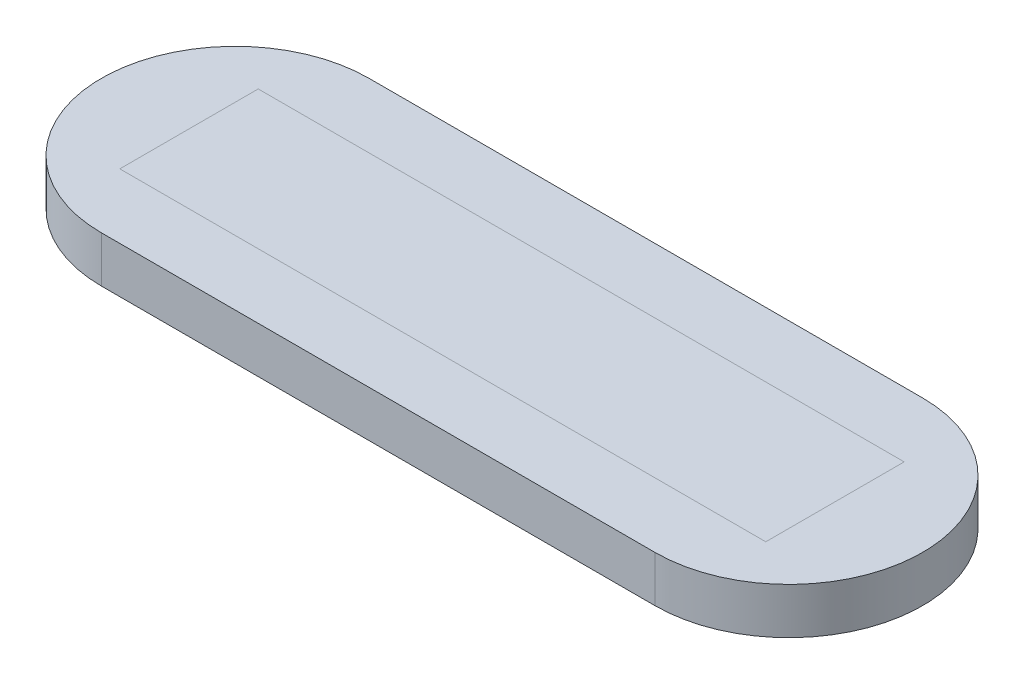
from build123d import *

# Parameters (mm, degrees)
BOSS_EXTRUDE1_DEPTH = 0.5


with BuildPart() as part:
    # Sketch1 → Boss-Extrude1 (new body)
    with BuildSketch(Plane(origin=(0, 0, 0), x_dir=(1, 0, 0), z_dir=(0, 1, 0))):
        with BuildLine():
            Line((-3, 1.45), (3, 1.45))
            ThreePointArc((3, 1.45), (4.45, 0), (3, -1.45))
            Line((3, -1.45), (-3, -1.45))
            ThreePointArc((-3, -1.45), (-4.45, 0), (-3, 1.45))
        make_face()
    extrude(amount=BOSS_EXTRUDE1_DEPTH)


solid = part.part
